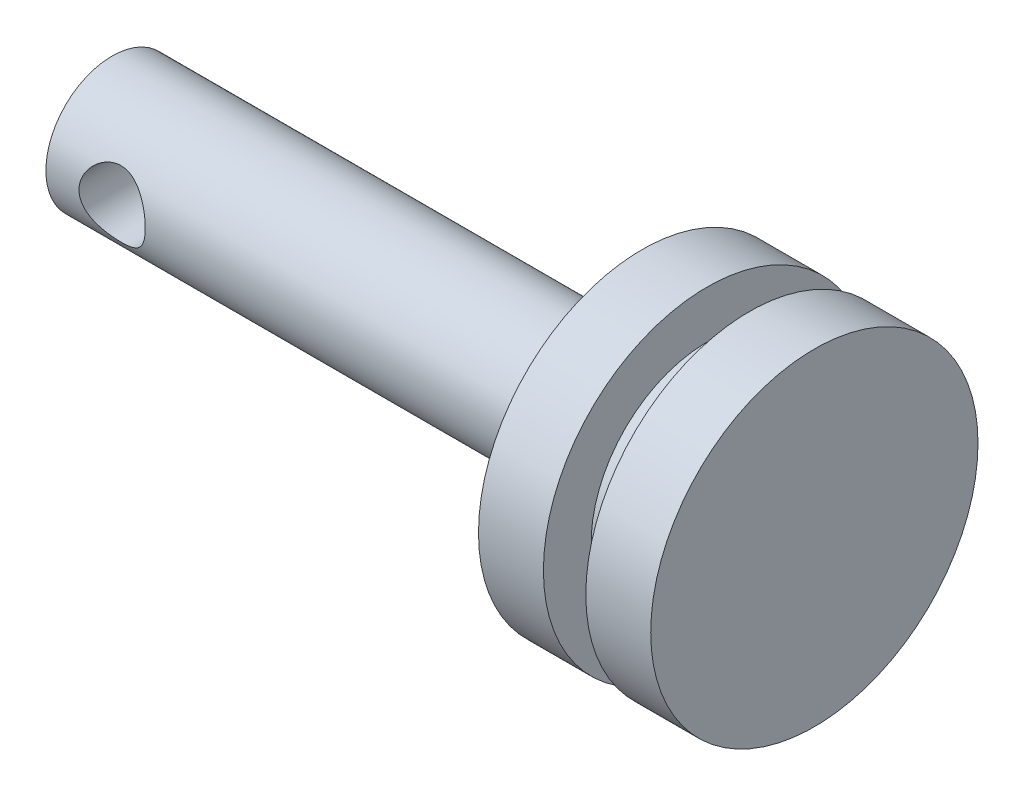
from build123d import *

# Parameters (mm, degrees)
CUT_EXTRUDE1_DEPTH      = 10
CUT_EXTRUDE1_DEPTH_BACK = 10
SKETCH2_R               = 2.5


with BuildPart() as part:
    # Sketch1 → Revolve1 (revolve)
    with BuildSketch(Plane.XY):
        Polygon((0, 0), (0, 5), (40, 5), (40, 12.35), (44.9, 12.35), (44.9, 8.75), (48.1, 8.75), (48.1, 12.35), (53, 12.35), (53, 0), align=None)
    revolve(axis=Axis((53, 0, 0), (-1, 0, 0)))

    # Sketch2 → Cut-Extrude1 (cut, two sides: drawn at the far end of the back side and taken through both)
    with BuildSketch(Plane.XY.offset(-CUT_EXTRUDE1_DEPTH_BACK)):
        with Locations((5, 0)):
            Circle(SKETCH2_R)
    extrude(amount=CUT_EXTRUDE1_DEPTH + CUT_EXTRUDE1_DEPTH_BACK, mode=Mode.SUBTRACT)


solid = part.part
